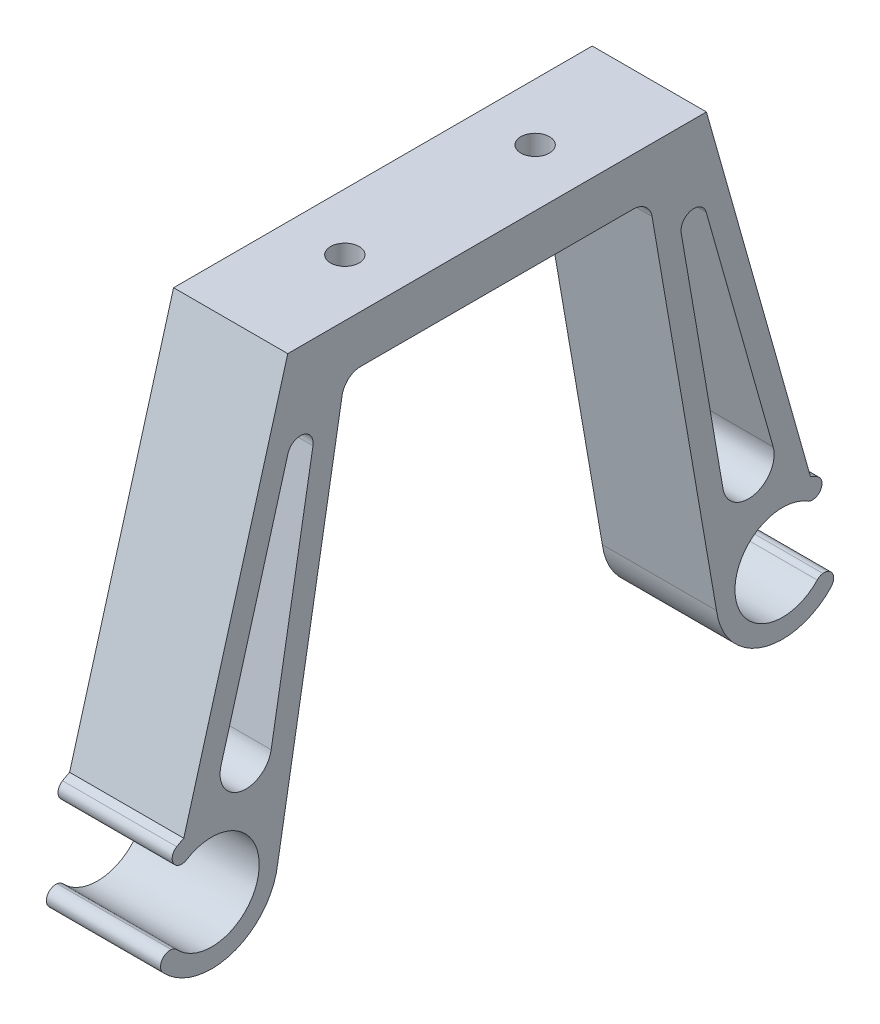
from build123d import *

# Parameters (mm, degrees)
SKETCH1_R           = 7
SKETCH1_R_2         = 5
BOSS_EXTRUDE1_DEPTH = 12
CUT_EXTRUDE1_DEPTH  = 40.522145691
FILLET1_R           = 1
BOSS_EXTRUDE2_START = -12
BOSS_EXTRUDE2_DEPTH = 12
FILLET2_R           = 2
CUT_EXTRUDE2_DEPTH  = 59.481408086
SKETCH7_R           = 1.5
CUT_EXTRUDE3_DEPTH  = 65.024019647


with BuildPart() as part:
    # Sketch1 → Boss-Extrude1 (new body)
    with BuildSketch(Plane(origin=(0, 0, 0), x_dir=(0, 0, -1), z_dir=(1, 0, 0))):
        with Locations((-30, 0)):
            Circle(SKETCH1_R)
        with Locations((-30, 0)):
            Circle(SKETCH1_R_2, mode=Mode.SUBTRACT)
    extrude(amount=BOSS_EXTRUDE1_DEPTH)

    # Sketch3 → Cut-Extrude1 (cut, through all)
    with BuildSketch(Plane(origin=(12, 0, 0), x_dir=(0, 0, -1), z_dir=(1, 0, 0))):
        Polygon((-26.132418273, 3.168881756), (-27.092472621, -4.067712446), (-40.54775296, -2.282646151), (-39.587698612, 4.953948051), align=None)
    extrude(amount=-CUT_EXTRUDE1_DEPTH, mode=Mode.SUBTRACT)

    # Fillet1
    fillet1_edges = [part.edges().sort_by_distance(p)[0] for p in [
        (6, 4.067712446, 32.907527379),
        (6, 4.403840469, 35.441156966),
        (6, -3.168881756, 33.867581727),
        (6, -2.832753733, 36.401211314),
    ]]
    fillet(fillet1_edges, radius=FILLET1_R - 0.0001)  # a hair under: the kernel refuses the full size

    # Sketch4 → Boss-Extrude2 (add)
    with BuildSketch(Plane(origin=(12, 0, 0), x_dir=(0, 0, -1), z_dir=(1, 0, 0)).offset(BOSS_EXTRUDE2_START)):
        with BuildLine():
            Line((-23.06080008, -0.92060006), (-16, 40))
            Line((-16, 40), (0, 40))
            Line((0, 40), (0, 45))
            Line((0, 45), (-22, 45))
            Line((-22, 45), (-32.927058907, 6.358641848))
            ThreePointArc((-32.927058907, 6.358641848), (-25.844141537, 5.632835914), (-23.06080008, -0.92060006))
        make_face()
    extrude(amount=BOSS_EXTRUDE2_DEPTH)

    # Fillet2
    fillet2_edges = [part.edges().sort_by_distance(p)[0] for p in [
        (6, 40, 16),
    ]]
    fillet(fillet2_edges, radius=FILLET2_R)

    # Sketch6 → Cut-Extrude2 (cut, through all)
    with BuildSketch(Plane(origin=(12, 0, 0), x_dir=(0, 0, -1), z_dir=(1, 0, 0))):
        with BuildLine():
            Line((-23.744298761, 9.820968741), (-19.349752742, 35.289394134))
            ThreePointArc((-19.349752742, 35.289394134), (-20.381234985, 36.835447129), (-21.979152767, 35.886292641))
            Line((-21.979152767, 35.886292641), (-29.011800399, 11.016740989))
            ThreePointArc((-29.011800399, 11.016740989), (-27.008090108, 7.643460534), (-23.744298761, 9.820968741))
        make_face()
    extrude(amount=-CUT_EXTRUDE2_DEPTH, mode=Mode.SUBTRACT)

    # Mirror9: part across plane


with BuildPart() as part_1:
    add(part.part)
    add(part.part.mirror(Plane(origin=(-56.505687485, 40, 0), x_dir=(1, 0, 0), z_dir=(0, 0, -1))))

    # Sketch7 → Cut-Extrude3 (cut, through all)
    with BuildSketch(Plane(origin=(0, 45, 0), x_dir=(1, 0, 0), z_dir=(0, 1, 0))):
        with Locations(Location((6, -10, 0), (0, 0, 270))):
            Circle(SKETCH7_R)
        with Locations(Location((6, 10, 0), (0, 0, 270))):
            Circle(SKETCH7_R)
    extrude(amount=-CUT_EXTRUDE3_DEPTH, mode=Mode.SUBTRACT)


solid = part_1.part
